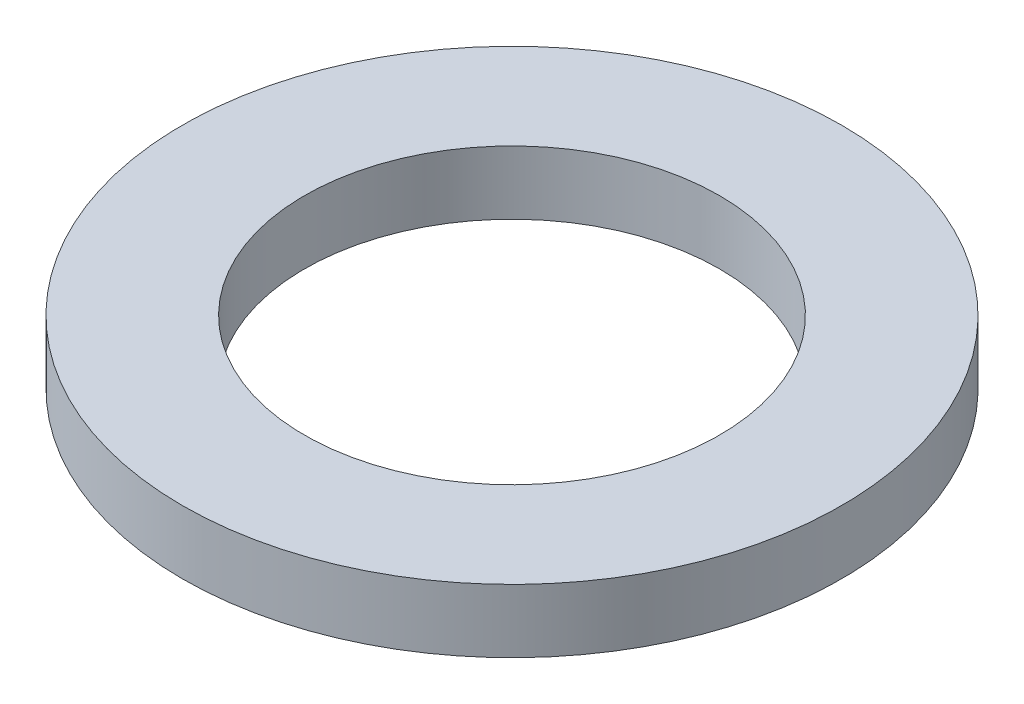
from build123d import *

# Parameters (mm, degrees)
SKETCH1_R           = 67.5
BOSS_EXTRUDE1_DEPTH = 13
SKETCH2_R           = 42.5
CUT_EXTRUDE1_DEPTH  = 97.340541829


with BuildPart() as part:
    # Sketch1 → Boss-Extrude1 (new body)
    with BuildSketch(Plane(origin=(0, 0, 0), x_dir=(1, 0, 0), z_dir=(0, 1, 0))):
        Circle(SKETCH1_R)
    extrude(amount=BOSS_EXTRUDE1_DEPTH)

    # Sketch2 → Cut-Extrude1 (cut, through all)
    with BuildSketch(Plane(origin=(0, 0, 0), x_dir=(1, 0, 0), z_dir=(0, 1, 0))):
        Circle(SKETCH2_R)
    extrude(amount=CUT_EXTRUDE1_DEPTH, mode=Mode.SUBTRACT)


solid = part.part
